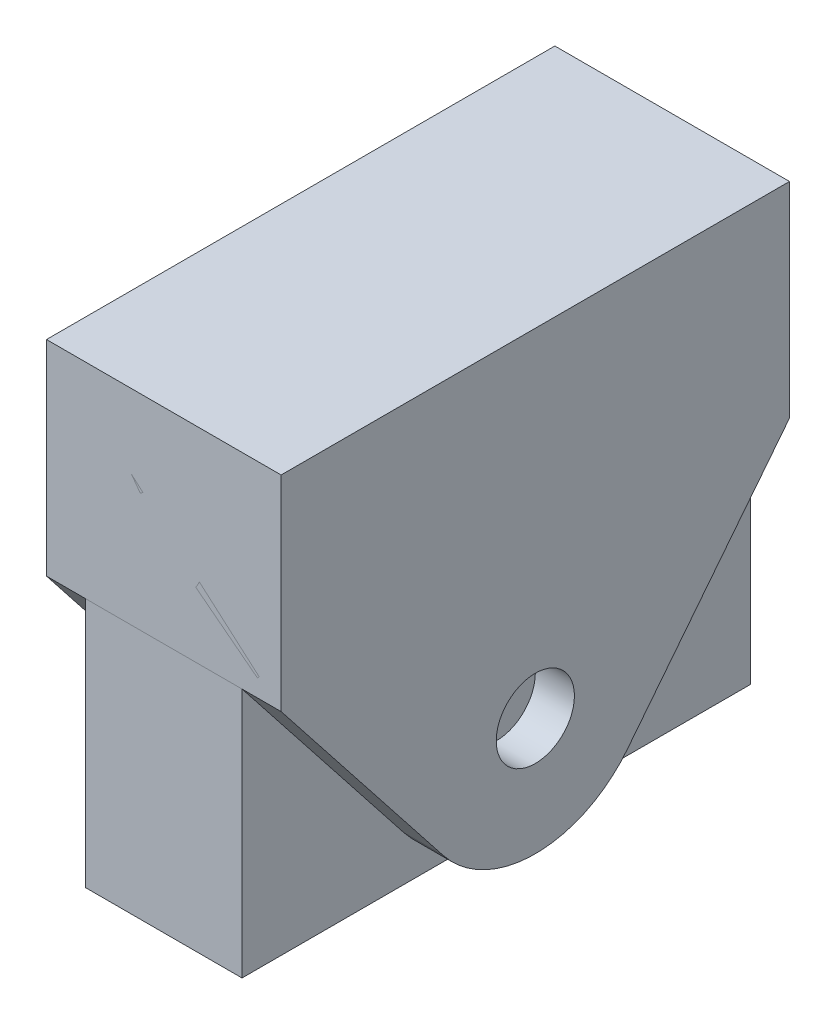
from build123d import *

# Parameters (mm, degrees)
BOSS_EXTRUDE1_DEPTH      = 5.159375
BOSS_EXTRUDE1_DEPTH_BACK = 5.159375
SKETCH1_R                = 0.79375
BOSS_EXTRUDE2_DEPTH      = 3.96875
BOSS_EXTRUDE2_DEPTH_BACK = 0.79375
SKETCH2_R                = 0.79375


with BuildPart() as part:
    # Sketch1 → Boss-Extrude1 (new, two sides: drawn at the far end of the back side and taken through both)
    with BuildSketch(Plane.XY.offset(-BOSS_EXTRUDE1_DEPTH_BACK)):
        with BuildLine():
            Line((0, 0), (0, 5.083121043))
            ThreePointArc((0, 5.083121043), (1.5875, 9.23925), (3.175, 5.083121043))
            Line((3.175, 5.083121043), (3.175, 0))
            Line((3.175, 0), (0, 0))
        make_face()
        with Locations((1.5875, 6.858)):
            Circle(SKETCH1_R, mode=Mode.SUBTRACT)
    extrude(amount=BOSS_EXTRUDE1_DEPTH + BOSS_EXTRUDE1_DEPTH_BACK)


with BuildPart() as body_2:
    # Sketch2 → Boss-Extrude2 (new, two sides: drawn at the far end of the back side and taken through both)
    with BuildSketch(Plane(origin=(0, 0, 0), x_dir=(0, 0, -1), z_dir=(1, 0, 0)).offset(-BOSS_EXTRUDE2_DEPTH_BACK)):
        with BuildLine():
            Line((-1.870115083, 0.907132929), (-5.159375, 5.08))
            Line((-5.159375, 5.08), (-5.159375, 9.23925))
            Line((-5.159375, 9.23925), (5.159375, 9.23925))
            Line((5.159375, 9.23925), (5.159375, 5.08))
            Line((5.159375, 5.08), (1.870115083, 0.907132929))
            ThreePointArc((1.870115083, 0.907132929), (0, 0), (-1.870115083, 0.907132929))
        make_face()
        with Locations((0, 2.38125)):
            Circle(SKETCH2_R, mode=Mode.SUBTRACT)
    extrude(amount=BOSS_EXTRUDE2_DEPTH + BOSS_EXTRUDE2_DEPTH_BACK)


solid = Compound([part.part, body_2.part])
